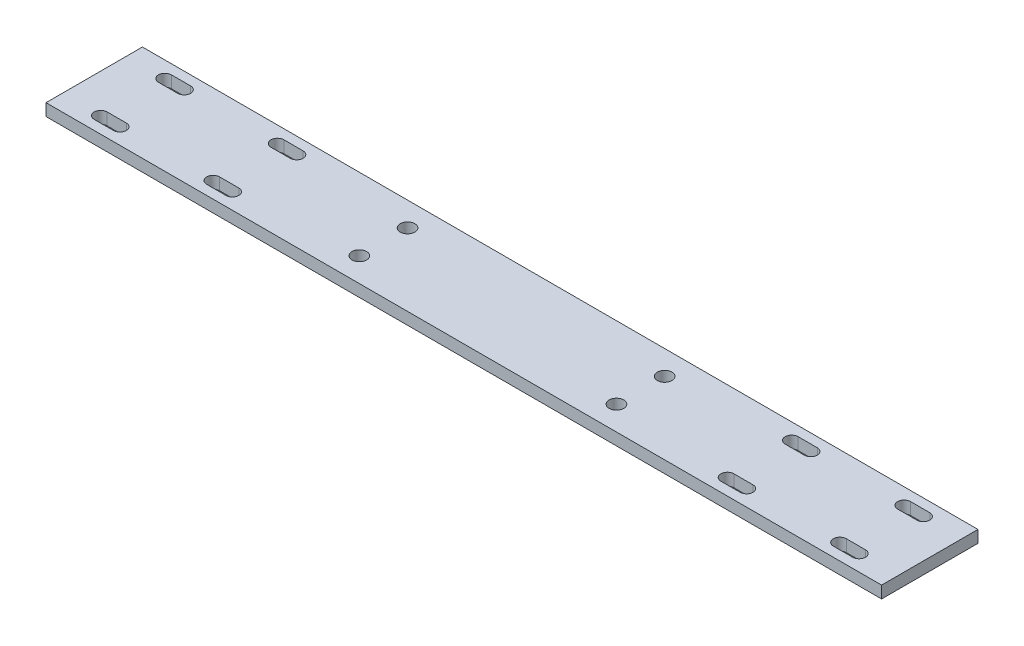
from build123d import *

# Parameters (mm, degrees)
SKETCH1_W                  = 330.2
SKETCH1_H                  = 38.1
BOSS_EXTRUDE1_DEPTH        = 2.38125
F_10_START                 = -2.38125
F_10_CLEARANCE_SLOT1_DEPTH = 4.7625
F_1_4_20_TAPPED_HOLE1_D    = 5.7912


# Read off the part's stored shape, not the designer's step: #10 Clearance Slot1
with BuildPart() as part:
    # Sketch1 → Boss-Extrude1 (new, symmetric)
    with BuildSketch(Plane(origin=(0, 0, 0), x_dir=(1, 0, 0), z_dir=(0, 1, 0))):
        Rectangle(SKETCH1_W, SKETCH1_H)
    extrude(amount=BOSS_EXTRUDE1_DEPTH, both=True)

    # #10 Clearance Slot1 outline → #10 Clearance Slot1 (cut)
    with BuildSketch(Plane(origin=(0, 0, 0), x_dir=(1, 0, 0), z_dir=(0, 1, 0)).offset(F_10_START)):
        with BuildLine():
            Line((142.2527, 10.1473), (149.8473, 10.1473))
            ThreePointArc((149.8473, 10.1473), (152.4, 12.7), (149.8473, 15.2527))
            Line((149.8473, 15.2527), (142.2527, 15.2527))
            ThreePointArc((142.2527, 15.2527), (139.7, 12.7), (142.2527, 10.1473))
        make_face()
        with BuildLine():
            ThreePointArc((105.3973, 10.1473), (107.95, 12.7), (105.3973, 15.2527))
            Line((105.3973, 15.2527), (97.8027, 15.2527))
            ThreePointArc((97.8027, 15.2527), (95.25, 12.7), (97.8027, 10.1473))
            Line((97.8027, 10.1473), (105.3973, 10.1473))
        make_face()
        with BuildLine():
            ThreePointArc((-142.2527, 10.1473), (-139.7, 12.7), (-142.2527, 15.2527))
            Line((-142.2527, 15.2527), (-149.8473, 15.2527))
            ThreePointArc((-149.8473, 15.2527), (-152.4, 12.7), (-149.8473, 10.1473))
            Line((-149.8473, 10.1473), (-142.2527, 10.1473))
        make_face()
        with BuildLine():
            ThreePointArc((-97.8027, 10.1473), (-95.25, 12.7), (-97.8027, 15.2527))
            Line((-97.8027, 15.2527), (-105.3973, 15.2527))
            ThreePointArc((-105.3973, 15.2527), (-107.95, 12.7), (-105.3973, 10.1473))
            Line((-105.3973, 10.1473), (-97.8027, 10.1473))
        make_face()
        with BuildLine():
            Line((142.2527, -15.2527), (149.8473, -15.2527))
            ThreePointArc((149.8473, -15.2527), (152.4, -12.7), (149.8473, -10.1473))
            Line((149.8473, -10.1473), (142.2527, -10.1473))
            ThreePointArc((142.2527, -10.1473), (139.7, -12.7), (142.2527, -15.2527))
        make_face()
        with BuildLine():
            ThreePointArc((105.3973, -15.2527), (107.95, -12.7), (105.3973, -10.1473))
            Line((105.3973, -10.1473), (97.8027, -10.1473))
            ThreePointArc((97.8027, -10.1473), (95.25, -12.7), (97.8027, -15.2527))
            Line((97.8027, -15.2527), (105.3973, -15.2527))
        make_face()
        with BuildLine():
            ThreePointArc((-97.8027, -15.2527), (-95.25, -12.7), (-97.8027, -10.1473))
            Line((-97.8027, -10.1473), (-105.3973, -10.1473))
            ThreePointArc((-105.3973, -10.1473), (-107.95, -12.7), (-105.3973, -15.2527))
            Line((-105.3973, -15.2527), (-97.8027, -15.2527))
        make_face()
        with BuildLine():
            ThreePointArc((-142.2527, -15.2527), (-139.7, -12.7), (-142.2527, -10.1473))
            Line((-142.2527, -10.1473), (-149.8473, -10.1473))
            ThreePointArc((-149.8473, -10.1473), (-152.4, -12.7), (-149.8473, -15.2527))
            Line((-149.8473, -15.2527), (-142.2527, -15.2527))
        make_face()
    extrude(amount=F_10_CLEARANCE_SLOT1_DEPTH, mode=Mode.SUBTRACT)

    # 1/4-20 Tapped Hole1 (through all)
    with Locations(Plane(origin=(0, 2.38125, 0), x_dir=(1, 0, 0), z_dir=(0, 1, 0))):
        with Locations((-50.8, 9.525), (-50.8, -9.525), (50.8, -9.525), (50.8, 9.525)):
            Hole(F_1_4_20_TAPPED_HOLE1_D / 2)


solid = part.part
